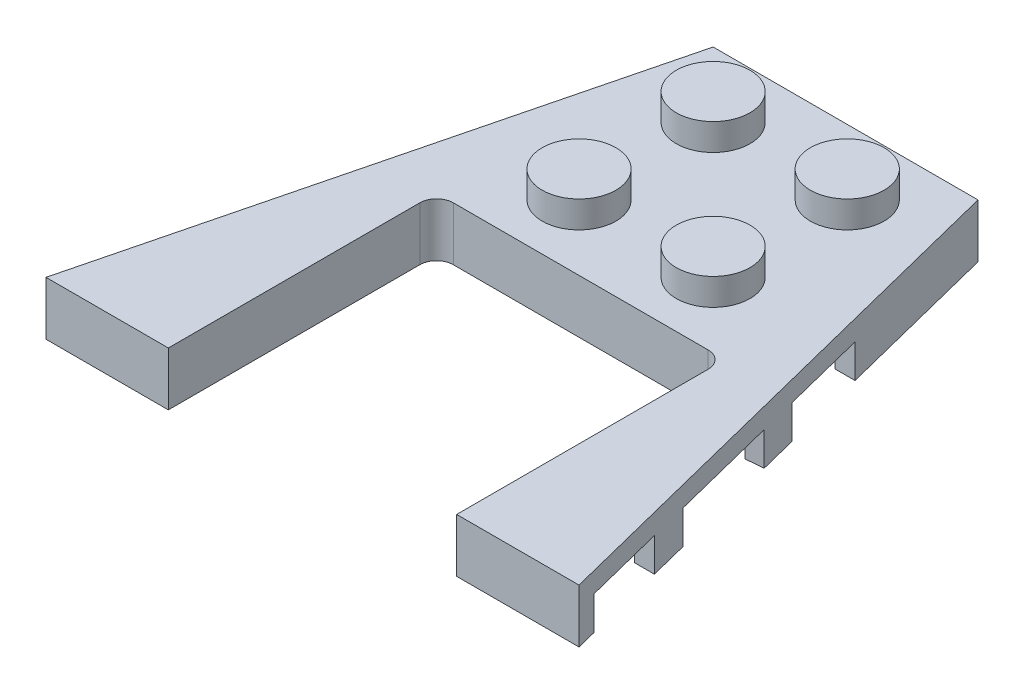
from build123d import *

# Parameters (mm, degrees)
BASEFRAMESKETCH_W           = 15.8
BASEFRAMESKETCH_H           = 3.2
BASEFRAME_DEPTH             = 7.9
STUDSSKETCH_R               = 2.197938665
STUDS_DEPTH                 = 1.6
MAINSTUDSPATTERN_COUNT      = 2
MAINSTUDSPATTERN_PITCH      = 8
MAINSTUDSPATTERN_COUNT_DIR2 = 2
MAINSTUDSPATTERN_PITCH_DIR2 = 8
MAINBASESHELL_T             = -1.2
UNDERCIRCLESKETCH_R         = 3.15
UNDERCIRCLESKETCH_R_2       = 2.4
UNDERCIRCLEEXTRUDE_DEPTH    = 1.6
ASHAPEDEDGECUT_DEPTH        = 2
MOVE_FACE2_DEPTH            = 3.2
FILLET11_R                  = 1
SKETCH120_W                 = 2.012808249
SKETCH120_H                 = 1.2
SKETCH120_W_2               = 1.2
SKETCH120_H_2               = 0.829639146
CUT_EXTRUDE44_DEPTH         = 2
SKETCH122_W                 = 1.2
SKETCH122_H                 = 3.019966153
CUT_EXTRUDE45_DEPTH         = 2
CUT_EXTRUDE46_DEPTH         = 34.570089444
BOSS_EXTRUDE28_REACH        = 33.841
SKETCH125_W                 = 0.808534165
SKETCH125_H                 = 7.497721331
SKETCH125_H_2               = 5.795554142
FILLET12_R                  = 1


# Read off the part's stored shape, not the designer's step: Move Face2
with BuildPart() as part:
    # BaseFrameSketch → BaseFrame (new, symmetric)
    with BuildSketch(Plane.XY):
        with Locations((-4.584729064, 1.6)):
            Rectangle(BASEFRAMESKETCH_W, BASEFRAMESKETCH_H)
    extrude(amount=BASEFRAME_DEPTH, both=True)

    # StudsSketch → Studs (add)
    with BuildSketch(Plane(origin=(0, 3.2, 0), x_dir=(1, 0, 0), z_dir=(0, 1, 0))):
        with Locations((-8.584729064, 4)):
            Circle(STUDSSKETCH_R)
    studs = extrude(amount=STUDS_DEPTH)

    # MainStudsPattern: Studs 2 × 2
    with Locations(*[(i * MAINSTUDSPATTERN_PITCH, 0, j * MAINSTUDSPATTERN_PITCH_DIR2) for i in range(MAINSTUDSPATTERN_COUNT) for j in range(MAINSTUDSPATTERN_COUNT_DIR2) if (i, j) != (0, 0)]):
        add(studs)

    # MainBaseShell
    mainbaseshell_openings = [part.faces().sort_by_distance(p)[0] for p in [
        (-4.584729064, 0, 0),
    ]]
    offset(amount=MAINBASESHELL_T, openings=mainbaseshell_openings, kind=Kind.INTERSECTION)

    # UnderCircleSketch → UnderCircleExtrude (add)
    with BuildSketch(Plane(origin=(0, 2, 0), x_dir=(-1, 0, 0), z_dir=(0, -1, 0))):
        with Locations(Location((4.584729064, 0, 0), (0, 0, 270))):
            Circle(UNDERCIRCLESKETCH_R)
        with Locations(Location((4.584729064, 0, 0), (0, 0, 270))):
            Circle(UNDERCIRCLESKETCH_R_2, mode=Mode.SUBTRACT)
    extrude(amount=UNDERCIRCLEEXTRUDE_DEPTH)

    # Sweep1: sweep along a curve in space
    with BuildLine() as sweep1_path:
        Line((3.315270936, 0, 7.9), (3.315270936, 3.2, 7.9))
    # Sketch10 → Sweep1 (sweep)
    with BuildSketch(Plane(origin=(0, 3.2, 0), x_dir=(1, 0, 0), z_dir=(0, 1, 0))):
        Polygon((-20.484729064, -16.11), (-13.184729064, -16.11), (-13.184729064, -7.9), (-12.484729064, -7.9), (-12.484729064, 7.9), align=None)
        Polygon((4.015270936, -7.9), (3.315270936, -7.9), (3.315270936, 7.9), (11.315270936, -16.11), (4.015270936, -16.11), align=None)
    sweep(path=sweep1_path.line)

    # Sketch11 → AShapedEdgeCut (cut)
    with BuildSketch(Plane(origin=(0, 0, 0), x_dir=(-1, 0, 0), z_dir=(0, -1, 0))):
        Polygon((-3.315270936, 3.352483875), (-3.598074089, 3.352483875), (-5.380624164, -1.900141374), (-6.580624164, -1.900141374), (-8.256846476, -6.930903588), (-3.315270936, -6.930903588), (-3.315270936, -4.81), (-5.328079185, -4.81), (-5.328079185, -3.61), (-3.315270936, -3.61), align=None)
        Polygon((-7.759680606, -8.895572671), (-7.759680606, -9.725211817), (-6.559680606, -9.725211817), (-6.559680606, -8.130903588), (-4.406736771, -8.130903588), (-4.406736771, -14.91), (-9.466166686, -14.91), (-9.466166686, -14.321814496), (-10.576862573, -13.893851901), (-8.911463413, -8.895572671), align=None)
        Polygon((-2.115270936, 4.601321399), (-2.895270936, 4.601321399), (-2.295270936, 6.7), (-2.115270936, 6.7), align=None)
        Polygon((18.635624814, -14.321814496), (19.746320701, -13.893851901), (18.080921541, -8.895572671), (16.929138734, -8.895572671), (16.929138734, -9.725211817), (15.729138734, -9.725211817), (15.729138734, -8.130903588), (13.576194899, -8.130903588), (13.576194899, -14.91), (18.635624814, -14.91), align=None)
        Polygon((12.484729064, -6.930903588), (17.426304604, -6.930903588), (15.750082292, -1.900141374), (14.550082292, -1.900141374), (12.767532217, 3.352483875), (12.484729064, 3.352483875), (12.484729064, -3.61), (14.497537313, -3.61), (14.497537313, -4.81), (12.484729064, -4.81), align=None)
        Polygon((12.064729064, 4.601321399), (11.464729064, 6.7), (11.284729064, 6.7), (11.284729064, 4.601321399), align=None)
    extrude(amount=-ASHAPEDEDGECUT_DEPTH, mode=Mode.SUBTRACT)

    # Move Face2 outline → Move Face2 (add)
    with BuildSketch(Plane(origin=(0, 0, 0), x_dir=(1, 0, 0), z_dir=(0, 1, 0))):
        Polygon((-13.184729064, -16.11), (-20.484729064, -16.11), (-23.080314237, -23.9), (-13.184729064, -23.9), align=None)
        Polygon((4.015270936, -16.11), (4.015270936, -23.9), (13.910856109, -23.9), (11.315270936, -16.11), align=None)
    extrude(amount=MOVE_FACE2_DEPTH)

    # Fillet11
    fillet11_edges = [part.edges().sort_by_distance(p)[0] for p in [
        (-13.184729064, 1.6, 7.9),
        (4.015270936, 1.6, 7.9),
    ]]
    fillet(fillet11_edges, radius=FILLET11_R)

    # Sketch120 → Cut-Extrude44 (cut)
    with BuildSketch(Plane(origin=(0, 0, 0), x_dir=(-1, 0, 0), z_dir=(0, -1, 0))):
        with Locations((-4.321675061, -4.21)):
            Rectangle(SKETCH120_W, SKETCH120_H)
        Polygon((-4.406736771, -16.11), (-4.406736771, -22.7), (-11.974329928, -22.7), (-11.557573226, -21.355984621), (-12.912753937, -20.904445858), (-11.315270936, -16.11), align=None)
        with Locations((-7.159680606, -9.310392244)):
            Rectangle(SKETCH120_W_2, SKETCH120_H_2)
        Polygon((13.576194899, -16.11), (20.484729064, -16.11), (22.082212066, -20.904445858), (20.727031354, -21.355984621), (21.143788056, -22.7), (13.576194899, -22.7), align=None)
        with Locations((16.329138734, -9.310392244)):
            Rectangle(SKETCH120_W_2, SKETCH120_H_2)
        with Locations((13.491133189, -4.21)):
            Rectangle(SKETCH120_W, SKETCH120_H)
    extrude(amount=-CUT_EXTRUDE44_DEPTH, mode=Mode.SUBTRACT)

    # Sweep30: sweep along a curve in space
    with BuildLine() as sweep30_path:
        Line((11.315270936, 2, 16.11), (11.315270936, 0, 16.11))
    # Sketch121 → Sweep30 (sweep)
    with BuildSketch(Plane(origin=(0, 0, 0), x_dir=(-1, 0, 0), z_dir=(0, -1, 0))):
        Polygon((-11.579975928, -16.904445858), (-4.406736771, -16.904445858), (-4.406736771, -15.858354428), (-11.231424015, -15.858354428), align=None)
        Polygon((13.576194899, -15.858354428), (20.400882143, -15.858354428), (20.749434056, -16.904445858), (13.576194899, -16.904445858), align=None)
    sweep(path=sweep30_path.line)

    # Sketch122 → Cut-Extrude45 (cut)
    with BuildSketch(Plane(origin=(0, 0, 0), x_dir=(-1, 0, 0), z_dir=(0, -1, 0))):
        with BuildLine():
            Line((-9.466166686, -14.321814496), (-9.706013399, -15.628624919))
            Line((-9.706013399, -15.628624919), (-9.645171378, -15.628624919))
            Line((-9.645171378, -15.628624919), (-4.39726815, -15.628624919))
            ThreePointArc((-4.39726815, -15.628624919), (-4.399635408, -15.269281271), (-4.406736771, -14.91))
            Line((-4.406736771, -14.91), (-9.360110841, -14.91))
            Line((-9.360110841, -14.91), (-9.466166686, -14.91))
            Line((-9.466166686, -14.91), (-9.466166686, -14.321814496))
        make_face()
        with BuildLine():
            Line((18.635624814, -14.321814496), (18.635624814, -14.91))
            Line((18.635624814, -14.91), (18.529568969, -14.91))
            Line((18.529568969, -14.91), (13.576194899, -14.91))
            ThreePointArc((13.576194899, -14.91), (13.569093536, -15.269281271), (13.566726278, -15.628624919))
            Line((13.566726278, -15.628624919), (18.814629506, -15.628624919))
            Line((18.814629506, -15.628624919), (18.875471527, -15.628624919))
            Line((18.875471527, -15.628624919), (18.635624814, -14.321814496))
        make_face()
        with Locations((-2.715270936, 1.842500799)):
            Rectangle(SKETCH122_W, SKETCH122_H)
        with Locations((11.884729064, 1.842500799)):
            Rectangle(SKETCH122_W, SKETCH122_H)
    extrude(amount=-CUT_EXTRUDE45_DEPTH, mode=Mode.SUBTRACT)

    # Sketch123 → Cut-Extrude46 (cut, through all)
    with BuildSketch(Plane(origin=(0, 0, 0), x_dir=(-1, 0, 0), z_dir=(0, -1, 0))):
        Polygon((-11.314156863, -23.9), (-13.910856109, -23.9), (-3.315270936, 7.9), align=None)
        Polygon((20.483614991, -23.9), (23.080314237, -23.9), (12.484729064, 7.9), align=None)
    extrude(amount=-CUT_EXTRUDE46_DEPTH, mode=Mode.SUBTRACT)

    # Sketch125 → Boss-Extrude28 (add, up to next)
    with BuildSketch(Plane(origin=(0, 0, 0), x_dir=(-1, 0, 0), z_dir=(0, -1, 0)), mode=Mode.PRIVATE) as boss_extrude28_sk1:
        Polygon((-3.598074089, 3.352483875), (-5.380624164, -1.900141374), (-4.580371971, -1.900141374), (-4.002886188, 0.332517722), (-2.115270936, 0.332517722), (-2.115270936, 1.524445932), (-3.694589414, 1.524445932), (-3.221760433, 3.352483875), align=None)
    boss_extrude28_tool1 = extrude(boss_extrude28_sk1.sketch, amount=-BOSS_EXTRUDE28_REACH, mode=Mode.PRIVATE) - part.part
    # Sketch125 → Boss-Extrude28 (add, up to next)
    with BuildSketch(Plane(origin=(0, 0, 0), x_dir=(-1, 0, 0), z_dir=(0, -1, 0)), mode=Mode.PRIVATE) as boss_extrude28_sk2:
        Polygon((13.749830099, -1.900141374), (14.550082292, -1.900141374), (12.767532217, 3.352483875), (12.391218561, 3.352483875), (12.864047542, 1.524445932), (11.284729064, 1.524445932), (11.284729064, 0.332517722), (13.172344316, 0.332517722), align=None)
    boss_extrude28_tool2 = extrude(boss_extrude28_sk2.sketch, amount=-BOSS_EXTRUDE28_REACH, mode=Mode.PRIVATE) - part.part
    # Sketch125 → Boss-Extrude28 (add, up to next)
    with BuildSketch(Plane(origin=(0, 0, 0), x_dir=(-1, 0, 0), z_dir=(0, -1, 0)), mode=Mode.PRIVATE) as boss_extrude28_sk3:
        Polygon((-6.559680606, -8.895572671), (-7.539983825, -8.895572671), (-7.603300806, -9.147292725), (-6.559680606, -9.230770127), (-6.295168575, -8.130903588), (-6.559680606, -8.130903588), align=None)
    boss_extrude28_tool3 = extrude(boss_extrude28_sk3.sketch, amount=-BOSS_EXTRUDE28_REACH, mode=Mode.PRIVATE) - part.part
    # Sketch125 → Boss-Extrude28 (add, up to next)
    with BuildSketch(Plane(origin=(0, 0, 0), x_dir=(-1, 0, 0), z_dir=(0, -1, 0)), mode=Mode.PRIVATE) as boss_extrude28_sk4:
        with Locations((-4.811003854, -11.879764254)):
            Rectangle(SKETCH125_W, SKETCH125_H)
    boss_extrude28_tool4 = extrude(boss_extrude28_sk4.sketch, amount=-BOSS_EXTRUDE28_REACH, mode=Mode.PRIVATE) - part.part
    # Sketch125 → Boss-Extrude28 (add, up to next)
    with BuildSketch(Plane(origin=(0, 0, 0), x_dir=(-1, 0, 0), z_dir=(0, -1, 0)), mode=Mode.PRIVATE) as boss_extrude28_sk5:
        Polygon((16.772758935, -9.147292725), (16.709441953, -8.895572671), (15.729138734, -8.895572671), (15.729138734, -8.130903588), (15.464626703, -8.130903588), (15.729138734, -9.230770127), align=None)
    boss_extrude28_tool5 = extrude(boss_extrude28_sk5.sketch, amount=-BOSS_EXTRUDE28_REACH, mode=Mode.PRIVATE) - part.part
    # Sketch125 → Boss-Extrude28 (add, up to next)
    with BuildSketch(Plane(origin=(0, 0, 0), x_dir=(-1, 0, 0), z_dir=(0, -1, 0)), mode=Mode.PRIVATE) as boss_extrude28_sk6:
        with Locations((-4.811003854, -19.802222929)):
            Rectangle(SKETCH125_W, SKETCH125_H_2)
    boss_extrude28_tool6 = extrude(boss_extrude28_sk6.sketch, amount=-BOSS_EXTRUDE28_REACH, mode=Mode.PRIVATE) - part.part
    # Sketch125 → Boss-Extrude28 (add, up to next)
    with BuildSketch(Plane(origin=(0, 0, 0), x_dir=(-1, 0, 0), z_dir=(0, -1, 0)), mode=Mode.PRIVATE) as boss_extrude28_sk7:
        Polygon((-8.602501167, -17.890331705), (-8.354514109, -16.904445858), (-9.554514109, -16.904445858), (-9.802501167, -17.890331705), align=None)
    boss_extrude28_tool7 = extrude(boss_extrude28_sk7.sketch, amount=-BOSS_EXTRUDE28_REACH, mode=Mode.PRIVATE) - part.part
    # Sketch125 → Boss-Extrude28 (add, up to next)
    with BuildSketch(Plane(origin=(0, 0, 0), x_dir=(-1, 0, 0), z_dir=(0, -1, 0)), mode=Mode.PRIVATE) as boss_extrude28_sk8:
        with Locations((13.980461981, -11.879764254)):
            Rectangle(SKETCH125_W, SKETCH125_H)
    boss_extrude28_tool8 = extrude(boss_extrude28_sk8.sketch, amount=-BOSS_EXTRUDE28_REACH, mode=Mode.PRIVATE) - part.part
    # Sketch125 → Boss-Extrude28 (add, up to next)
    with BuildSketch(Plane(origin=(0, 0, 0), x_dir=(-1, 0, 0), z_dir=(0, -1, 0)), mode=Mode.PRIVATE) as boss_extrude28_sk9:
        with Locations((13.980461981, -19.802222929)):
            Rectangle(SKETCH125_W, SKETCH125_H_2)
    boss_extrude28_tool9 = extrude(boss_extrude28_sk9.sketch, amount=-BOSS_EXTRUDE28_REACH, mode=Mode.PRIVATE) - part.part
    # Sketch125 → Boss-Extrude28 (add, up to next)
    with BuildSketch(Plane(origin=(0, 0, 0), x_dir=(-1, 0, 0), z_dir=(0, -1, 0)), mode=Mode.PRIVATE) as boss_extrude28_sk10:
        Polygon((18.723972237, -16.904445858), (17.523972237, -16.904445858), (17.771959295, -17.890331705), (18.971959295, -17.890331705), align=None)
    boss_extrude28_tool10 = extrude(boss_extrude28_sk10.sketch, amount=-BOSS_EXTRUDE28_REACH, mode=Mode.PRIVATE) - part.part
    add(boss_extrude28_tool1.solids().sort_by_distance((3.766497, 0, -0.611125))[0])
    add(boss_extrude28_tool2.solids().sort_by_distance((-12.935955, 0, -0.611125))[0])
    add(boss_extrude28_tool3.solids().sort_by_distance((7.049832, 0, 8.912663))[0])
    add(boss_extrude28_tool4.solids().sort_by_distance((4.811004, 0, 11.879764))[0])
    add(boss_extrude28_tool5.solids().sort_by_distance((-16.724526, 0, 9.025602))[0])
    add(boss_extrude28_tool6.solids().sort_by_distance((4.811004, 0, 19.802223))[0])
    add(boss_extrude28_tool7.solids().sort_by_distance((9.078508, 0, 17.397389))[0])
    add(boss_extrude28_tool8.solids().sort_by_distance((-13.980462, 0, 11.879764))[0])
    add(boss_extrude28_tool9.solids().sort_by_distance((-13.980462, 0, 19.802223))[0])
    add(boss_extrude28_tool10.solids().sort_by_distance((-18.247966, 0, 17.397389))[0])

    # Fillet12
    fillet12_edges = [part.edges().sort_by_distance(p)[0] for p in [
        (-11.284729064, 1, -1.524445932),
        (2.115270936, 1, -1.524445932),
    ]]
    fillet(fillet12_edges, radius=FILLET12_R)


solid = part.part
